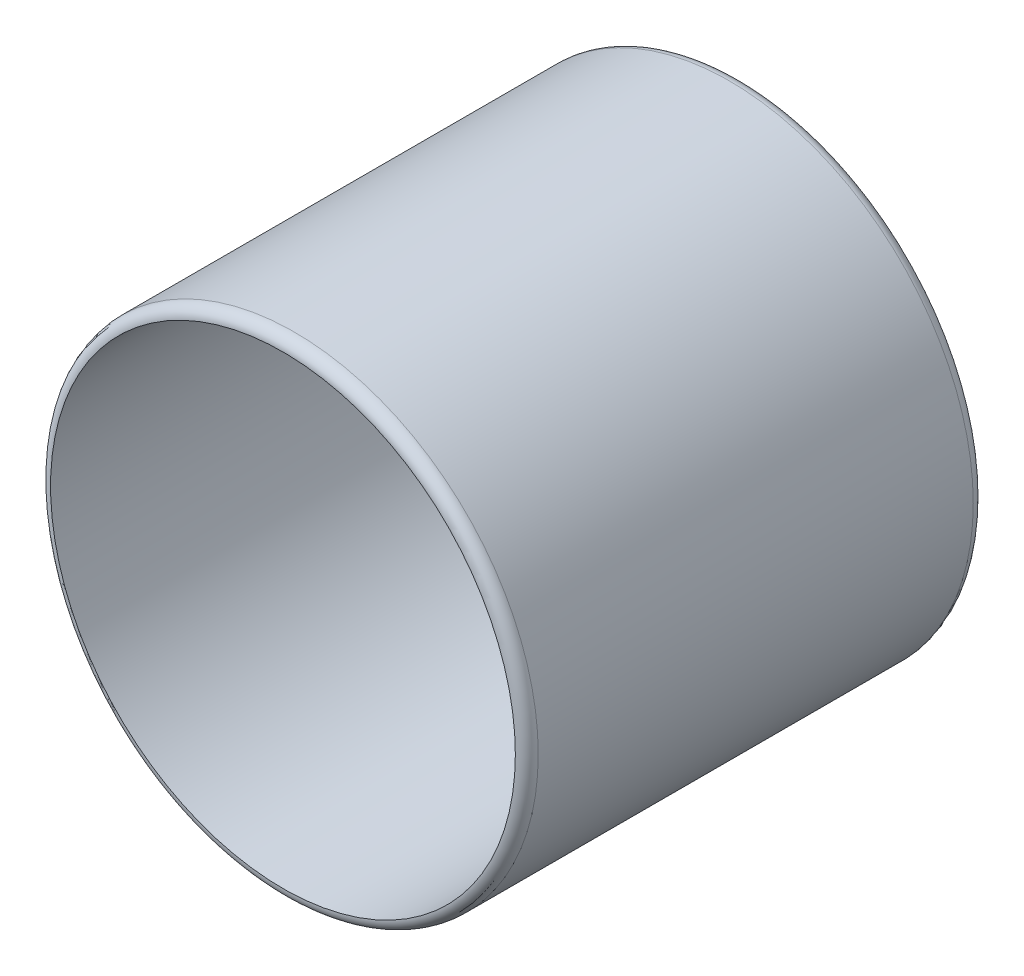
from build123d import *

# Parameters (mm, degrees)
SKETCH1_R           = 213
SKETCH1_R_2         = 203
EXTRUDE_THIN1_DEPTH = 400
FILLET1_R           = 10


with BuildPart() as part:
    # Sketch1 → Extrude-Thin1 (new body)
    with BuildSketch(Plane.XY):
        Circle(SKETCH1_R)
        Circle(SKETCH1_R_2, mode=Mode.SUBTRACT)
    extrude(amount=EXTRUDE_THIN1_DEPTH)

    # Fillet1
    fillet1_edges = [part.edges().sort_by_distance(p)[0] for p in [
        (-213, 0, 0),
        (-213, 0, 400),
    ]]
    fillet(fillet1_edges, radius=FILLET1_R - 0.0001)  # a hair under: the kernel refuses the full size


solid = part.part
